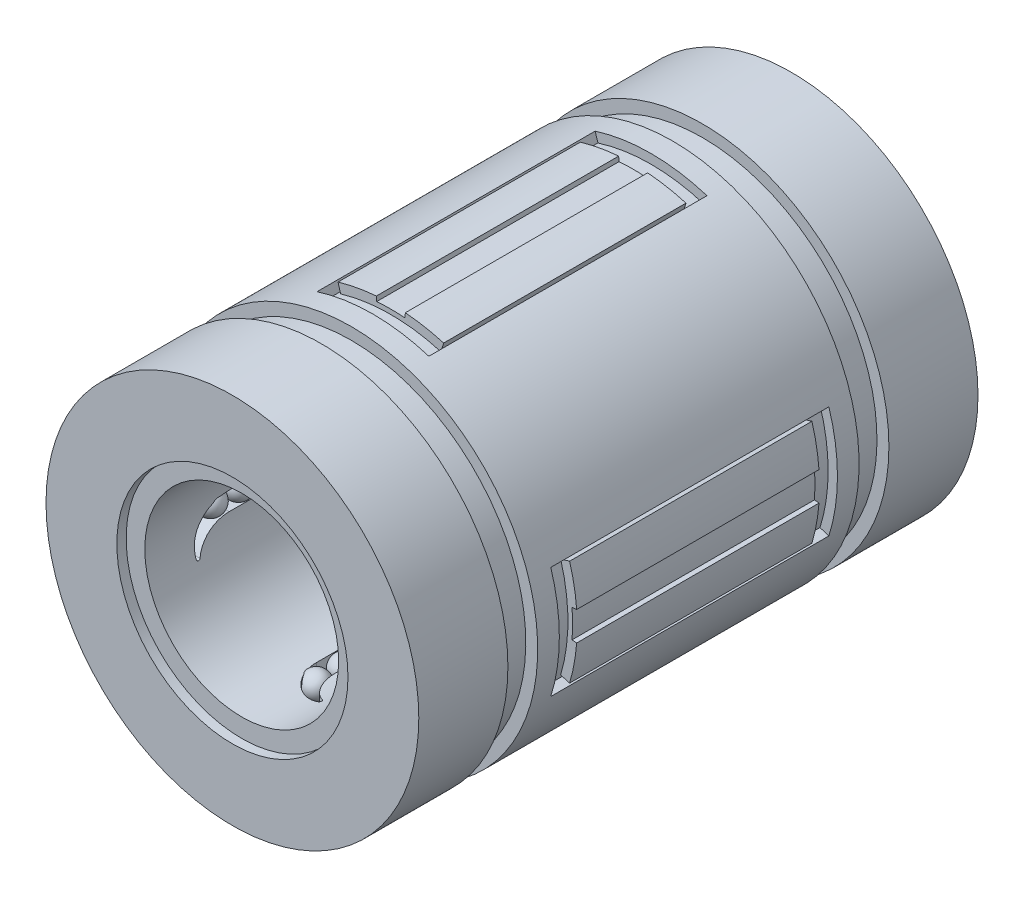
from build123d import *

# Parameters (mm, degrees)
SKETCH3_R               = 6.35
SKETCH3_R_2             = 3.302
BOSS_EXTRUDE1_DEPTH     = 9.525
CUT_EXTRUDE1_START      = -0.3175
SKETCH4_R               = 3.937
SKETCH4_R_2             = 3.302
CUT_EXTRUDE1_DEPTH      = 0.3175
CUT_EXTRUDE2_DEPTH      = 4.7371
BOSS_EXTRUDE2_DEPTH     = 4.1275
CUT_EXTRUDE3_REACH      = 15.091
CUT_EXTRUDE3_END_RADIUS = 3.937
LPATTERN1_COUNT         = 8
LPATTERN1_PITCH         = 0.9525
CIRPATTERN1_COUNT       = 4
CIRPATTERN2_COUNT       = 4
SKETCH9_W               = 1.015999937
SKETCH9_H               = 0.4064


with BuildPart() as part:
    # Sketch3 → Boss-Extrude1 (new, symmetric)
    with BuildSketch(Plane.XY):
        with Locations(Location((0, 0, 0), (0, 0, 180))):
            Circle(SKETCH3_R)
        with Locations(Location((0, 0, 0), (0, 0, 180))):
            Circle(SKETCH3_R_2, mode=Mode.SUBTRACT)
    extrude(amount=BOSS_EXTRUDE1_DEPTH, both=True)

    # Sketch4 → Cut-Extrude1 (cut)
    with BuildSketch(Plane.XY.offset(9.525).offset(CUT_EXTRUDE1_START)):
        Circle(SKETCH4_R)
        with Locations(Location((0, 0, 0), (0, 0, 180))):
            Circle(SKETCH4_R_2, mode=Mode.SUBTRACT)
    cut_extrude1 = extrude(amount=CUT_EXTRUDE1_DEPTH, mode=Mode.SUBTRACT)

    # Mirror1: Cut-Extrude1 across plane
    add(cut_extrude1.mirror(Plane.XY), mode=Mode.SUBTRACT)

    # Sketch5 → Cut-Extrude2 (cut, symmetric)
    with BuildSketch(Plane.XY):
        with BuildLine():
            Line((-1.905, 6.057513929), (-1.80975, 5.754638233))
            ThreePointArc((-1.80975, 5.754638233), (0, 6.0325), (1.80975, 5.754638233))
            Line((1.80975, 5.754638233), (1.905, 6.057513929))
            ThreePointArc((1.905, 6.057513929), (0, 6.35), (-1.905, 6.057513929))
        make_face()
    cut_extrude2 = extrude(amount=CUT_EXTRUDE2_DEPTH, both=True, mode=Mode.SUBTRACT)

    # Sketch6 → Boss-Extrude2 (add, symmetric)
    with BuildSketch(Plane.XY):
        with BuildLine():
            Line((1.798991664, 6.089838175), (1.709042081, 5.785346266))
            ThreePointArc((1.709042081, 5.785346266), (0, 6.0325), (-1.709042081, 5.785346266))
            Line((-1.709042081, 5.785346266), (-1.798991664, 6.089838175))
            ThreePointArc((-1.798991664, 6.089838175), (-1.152575174, 6.244523238), (-0.493530828, 6.330791998))
            Line((-0.493530828, 6.330791998), (-0.481192558, 6.172522198))
            ThreePointArc((-0.481192558, 6.172522198), (0, 6.19125), (0.481192558, 6.172522198))
            Line((0.481192558, 6.172522198), (0.493530828, 6.330791998))
            ThreePointArc((0.493530828, 6.330791998), (1.152575174, 6.244523238), (1.798991664, 6.089838175))
        make_face()
    boss_extrude2 = extrude(amount=BOSS_EXTRUDE2_DEPTH, both=True)

    # Cut-Extrude3: up to this cylinder (the profile starts inside it)
    cut_extrude3_end = Plane(origin=(0, 0, 0), z_dir=(0, 0, 1)) * Cylinder(CUT_EXTRUDE3_END_RADIUS, 39.056, mode=Mode.PRIVATE)
    # Sketch7 → Cut-Extrude3 (cut, up to the surface)
    with BuildSketch(Plane(origin=(0, 0, 0), x_dir=(0, 0, -1), z_dir=(1, 0, 0)), mode=Mode.PRIVATE) as cut_extrude3_sk1:
        with BuildLine():
            Line((-6.349999936, -0.3175), (6.349999936, -0.3175))
            ThreePointArc((6.349999936, -0.3175), (7.028843484, -0.514154094), (7.497454961, -1.043214278))
            ThreePointArc((7.497454961, -1.043214278), (7.567139834, -1.078294949), (7.618239701, -1.019342098))
            ThreePointArc((7.618239701, -1.019342098), (7.271354767, -0.078426052), (6.349999936, 0.3175))
            Line((6.349999936, 0.3175), (-6.349999936, 0.3175))
            ThreePointArc((-6.349999936, 0.3175), (-7.271354767, -0.078426052), (-7.618239701, -1.019342098))
            ThreePointArc((-7.618239701, -1.019342098), (-7.567139834, -1.078294949), (-7.497454961, -1.043214278))
            ThreePointArc((-7.497454961, -1.043214278), (-7.028843484, -0.514154094), (-6.349999936, -0.3175))
        make_face()
    cut_extrude3_tool1 = extrude(cut_extrude3_sk1.sketch, amount=-CUT_EXTRUDE3_REACH, mode=Mode.PRIVATE) & cut_extrude3_end
    cut_extrude3 = cut_extrude3_tool1.solids().sort_by_distance((0, -0.040905, 0))[0]
    add(cut_extrude3, mode=Mode.SUBTRACT)

    # Sketch8 → Revolve1 (revolve)
    with BuildSketch(Plane.XY):
        with BuildLine():
            Line((-3.605438414, 0.430438414), (-3.605438414, -0.430438414))
            ThreePointArc((-3.605438414, -0.430438414), (-3.175, 0), (-3.605438414, 0.430438414))
        make_face()
    revolve1 = revolve(axis=Axis((-3.605438414, 0.430438414, 0), (0, -1, 0)))

    # LPattern1: Revolve1 ×8
    with Locations(*[(0, 0, -i * LPATTERN1_PITCH) for i in range(1, LPATTERN1_COUNT)]):
        add(revolve1)

    # Mirror2 copy 1 sketch → Mirror2 copy 1 (revolve)
    with BuildSketch(Plane(origin=(0, 0, 0.9525), x_dir=(1, 0, 0), z_dir=(0, 0, -1))):
        with BuildLine():
            Line((-3.605438414, -0.430438414), (-3.605438414, 0.430438414))
            ThreePointArc((-3.605438414, 0.430438414), (-3.175, 0), (-3.605438414, -0.430438414))
        make_face()
    revolve(axis=Axis((-3.605438414, 0.430438414, 0.9525), (0, 1, 0)))

    # Mirror2 copy 2 sketch → Mirror2 copy 2 (revolve)
    with BuildSketch(Plane(origin=(0, 0, 1.905), x_dir=(1, 0, 0), z_dir=(0, 0, -1))):
        with BuildLine():
            Line((-3.605438414, -0.430438414), (-3.605438414, 0.430438414))
            ThreePointArc((-3.605438414, 0.430438414), (-3.175, 0), (-3.605438414, -0.430438414))
        make_face()
    revolve(axis=Axis((-3.605438414, 0.430438414, 1.905), (0, 1, 0)))

    # Mirror2 copy 3 sketch → Mirror2 copy 3 (revolve)
    with BuildSketch(Plane(origin=(0, 0, 2.8575), x_dir=(1, 0, 0), z_dir=(0, 0, -1))):
        with BuildLine():
            Line((-3.605438414, -0.430438414), (-3.605438414, 0.430438414))
            ThreePointArc((-3.605438414, 0.430438414), (-3.175, 0), (-3.605438414, -0.430438414))
        make_face()
    revolve(axis=Axis((-3.605438414, 0.430438414, 2.8575), (0, 1, 0)))

    # Mirror2 copy 4 sketch → Mirror2 copy 4 (revolve)
    with BuildSketch(Plane(origin=(0, 0, 3.81), x_dir=(1, 0, 0), z_dir=(0, 0, -1))):
        with BuildLine():
            Line((-3.605438414, -0.430438414), (-3.605438414, 0.430438414))
            ThreePointArc((-3.605438414, 0.430438414), (-3.175, 0), (-3.605438414, -0.430438414))
        make_face()
    revolve(axis=Axis((-3.605438414, 0.430438414, 3.81), (0, 1, 0)))

    # Mirror2 copy 5 sketch → Mirror2 copy 5 (revolve)
    with BuildSketch(Plane(origin=(0, 0, 4.7625), x_dir=(1, 0, 0), z_dir=(0, 0, -1))):
        with BuildLine():
            Line((-3.605438414, -0.430438414), (-3.605438414, 0.430438414))
            ThreePointArc((-3.605438414, 0.430438414), (-3.175, 0), (-3.605438414, -0.430438414))
        make_face()
    revolve(axis=Axis((-3.605438414, 0.430438414, 4.7625), (0, 1, 0)))

    # Mirror2 copy 6 sketch → Mirror2 copy 6 (revolve)
    with BuildSketch(Plane(origin=(0, 0, 5.715), x_dir=(1, 0, 0), z_dir=(0, 0, -1))):
        with BuildLine():
            Line((-3.605438414, -0.430438414), (-3.605438414, 0.430438414))
            ThreePointArc((-3.605438414, 0.430438414), (-3.175, 0), (-3.605438414, -0.430438414))
        make_face()
    revolve(axis=Axis((-3.605438414, 0.430438414, 5.715), (0, 1, 0)))

    # Mirror2 copy 7 sketch → Mirror2 copy 7 (revolve)
    with BuildSketch(Plane(origin=(0, 0, 6.6675), x_dir=(1, 0, 0), z_dir=(0, 0, -1))):
        with BuildLine():
            Line((-3.605438414, -0.430438414), (-3.605438414, 0.430438414))
            ThreePointArc((-3.605438414, 0.430438414), (-3.175, 0), (-3.605438414, -0.430438414))
        make_face()
    revolve(axis=Axis((-3.605438414, 0.430438414, 6.6675), (0, 1, 0)))

    # Mirror2 copy 8 sketch → Mirror2 copy 8 (revolve)
    with BuildSketch(Plane(origin=(0, 0, 0), x_dir=(1, 0, 0), z_dir=(0, 0, -1))):
        with BuildLine():
            Line((-3.605438414, -0.430438414), (-3.605438414, 0.430438414))
            ThreePointArc((-3.605438414, 0.430438414), (-3.175, 0), (-3.605438414, -0.430438414))
        make_face()
    revolve(axis=Axis((-3.605438414, 0.430438414, 0), (0, 1, 0)))

    # CirPattern1: Boss-Extrude2, Cut-Extrude3, Revolve1 ×4 about axis
    cirpattern1_axis = Axis((0, 0, 0), (0, 0, 1))
    add([boss_extrude2.rotate(cirpattern1_axis, i * 360 / CIRPATTERN1_COUNT) for i in range(1, CIRPATTERN1_COUNT)])
    add([cut_extrude3.rotate(cirpattern1_axis, i * 360 / CIRPATTERN1_COUNT) for i in range(1, CIRPATTERN1_COUNT)], mode=Mode.SUBTRACT)
    add([revolve1.rotate(cirpattern1_axis, i * 360 / CIRPATTERN1_COUNT) for i in range(1, CIRPATTERN1_COUNT)])

    # CirPattern1 copy 1 sketch → CirPattern1 copy 1 (revolve)
    with BuildSketch(Plane(origin=(0, 0, -0.9525), x_dir=(0, 1, 0), z_dir=(0, 0, 1))):
        with BuildLine():
            Line((-3.605438414, 0.430438414), (-3.605438414, -0.430438414))
            ThreePointArc((-3.605438414, -0.430438414), (-3.175, 0), (-3.605438414, 0.430438414))
        make_face()
    revolve(axis=Axis((-0.430438414, -3.605438414, -0.9525), (1, 0, 0)))

    # CirPattern1 copy 2 sketch → CirPattern1 copy 2 (revolve)
    with BuildSketch(Plane(origin=(0, 0, -0.9525), x_dir=(-1, 0, 0), z_dir=(0, 0, 1))):
        with BuildLine():
            Line((-3.605438414, 0.430438414), (-3.605438414, -0.430438414))
            ThreePointArc((-3.605438414, -0.430438414), (-3.175, 0), (-3.605438414, 0.430438414))
        make_face()
    revolve(axis=Axis((3.605438414, -0.430438414, -0.9525), (0, 1, 0)))

    # CirPattern1 copy 3 sketch → CirPattern1 copy 3 (revolve)
    with BuildSketch(Plane(origin=(0, 0, -0.9525), x_dir=(0, -1, 0), z_dir=(0, 0, 1))):
        with BuildLine():
            Line((-3.605438414, 0.430438414), (-3.605438414, -0.430438414))
            ThreePointArc((-3.605438414, -0.430438414), (-3.175, 0), (-3.605438414, 0.430438414))
        make_face()
    revolve(axis=Axis((0.430438414, 3.605438414, -0.9525), (-1, 0, 0)))

    # CirPattern1 copy 4 sketch → CirPattern1 copy 4 (revolve)
    with BuildSketch(Plane(origin=(0, 0, -1.905), x_dir=(0, 1, 0), z_dir=(0, 0, 1))):
        with BuildLine():
            Line((-3.605438414, 0.430438414), (-3.605438414, -0.430438414))
            ThreePointArc((-3.605438414, -0.430438414), (-3.175, 0), (-3.605438414, 0.430438414))
        make_face()
    revolve(axis=Axis((-0.430438414, -3.605438414, -1.905), (1, 0, 0)))

    # CirPattern1 copy 5 sketch → CirPattern1 copy 5 (revolve)
    with BuildSketch(Plane(origin=(0, 0, -1.905), x_dir=(-1, 0, 0), z_dir=(0, 0, 1))):
        with BuildLine():
            Line((-3.605438414, 0.430438414), (-3.605438414, -0.430438414))
            ThreePointArc((-3.605438414, -0.430438414), (-3.175, 0), (-3.605438414, 0.430438414))
        make_face()
    revolve(axis=Axis((3.605438414, -0.430438414, -1.905), (0, 1, 0)))

    # CirPattern1 copy 6 sketch → CirPattern1 copy 6 (revolve)
    with BuildSketch(Plane(origin=(0, 0, -1.905), x_dir=(0, -1, 0), z_dir=(0, 0, 1))):
        with BuildLine():
            Line((-3.605438414, 0.430438414), (-3.605438414, -0.430438414))
            ThreePointArc((-3.605438414, -0.430438414), (-3.175, 0), (-3.605438414, 0.430438414))
        make_face()
    revolve(axis=Axis((0.430438414, 3.605438414, -1.905), (-1, 0, 0)))

    # CirPattern1 copy 7 sketch → CirPattern1 copy 7 (revolve)
    with BuildSketch(Plane(origin=(0, 0, -2.8575), x_dir=(0, 1, 0), z_dir=(0, 0, 1))):
        with BuildLine():
            Line((-3.605438414, 0.430438414), (-3.605438414, -0.430438414))
            ThreePointArc((-3.605438414, -0.430438414), (-3.175, 0), (-3.605438414, 0.430438414))
        make_face()
    revolve(axis=Axis((-0.430438414, -3.605438414, -2.8575), (1, 0, 0)))

    # CirPattern1 copy 8 sketch → CirPattern1 copy 8 (revolve)
    with BuildSketch(Plane(origin=(0, 0, -2.8575), x_dir=(-1, 0, 0), z_dir=(0, 0, 1))):
        with BuildLine():
            Line((-3.605438414, 0.430438414), (-3.605438414, -0.430438414))
            ThreePointArc((-3.605438414, -0.430438414), (-3.175, 0), (-3.605438414, 0.430438414))
        make_face()
    revolve(axis=Axis((3.605438414, -0.430438414, -2.8575), (0, 1, 0)))

    # CirPattern1 copy 9 sketch → CirPattern1 copy 9 (revolve)
    with BuildSketch(Plane(origin=(0, 0, -2.8575), x_dir=(0, -1, 0), z_dir=(0, 0, 1))):
        with BuildLine():
            Line((-3.605438414, 0.430438414), (-3.605438414, -0.430438414))
            ThreePointArc((-3.605438414, -0.430438414), (-3.175, 0), (-3.605438414, 0.430438414))
        make_face()
    revolve(axis=Axis((0.430438414, 3.605438414, -2.8575), (-1, 0, 0)))

    # CirPattern1 copy 10 sketch → CirPattern1 copy 10 (revolve)
    with BuildSketch(Plane(origin=(0, 0, -3.81), x_dir=(0, 1, 0), z_dir=(0, 0, 1))):
        with BuildLine():
            Line((-3.605438414, 0.430438414), (-3.605438414, -0.430438414))
            ThreePointArc((-3.605438414, -0.430438414), (-3.175, 0), (-3.605438414, 0.430438414))
        make_face()
    revolve(axis=Axis((-0.430438414, -3.605438414, -3.81), (1, 0, 0)))

    # CirPattern1 copy 11 sketch → CirPattern1 copy 11 (revolve)
    with BuildSketch(Plane(origin=(0, 0, -3.81), x_dir=(-1, 0, 0), z_dir=(0, 0, 1))):
        with BuildLine():
            Line((-3.605438414, 0.430438414), (-3.605438414, -0.430438414))
            ThreePointArc((-3.605438414, -0.430438414), (-3.175, 0), (-3.605438414, 0.430438414))
        make_face()
    revolve(axis=Axis((3.605438414, -0.430438414, -3.81), (0, 1, 0)))

    # CirPattern1 copy 12 sketch → CirPattern1 copy 12 (revolve)
    with BuildSketch(Plane(origin=(0, 0, -3.81), x_dir=(0, -1, 0), z_dir=(0, 0, 1))):
        with BuildLine():
            Line((-3.605438414, 0.430438414), (-3.605438414, -0.430438414))
            ThreePointArc((-3.605438414, -0.430438414), (-3.175, 0), (-3.605438414, 0.430438414))
        make_face()
    revolve(axis=Axis((0.430438414, 3.605438414, -3.81), (-1, 0, 0)))

    # CirPattern1 copy 13 sketch → CirPattern1 copy 13 (revolve)
    with BuildSketch(Plane(origin=(0, 0, -4.7625), x_dir=(0, 1, 0), z_dir=(0, 0, 1))):
        with BuildLine():
            Line((-3.605438414, 0.430438414), (-3.605438414, -0.430438414))
            ThreePointArc((-3.605438414, -0.430438414), (-3.175, 0), (-3.605438414, 0.430438414))
        make_face()
    revolve(axis=Axis((-0.430438414, -3.605438414, -4.7625), (1, 0, 0)))

    # CirPattern1 copy 14 sketch → CirPattern1 copy 14 (revolve)
    with BuildSketch(Plane(origin=(0, 0, -4.7625), x_dir=(-1, 0, 0), z_dir=(0, 0, 1))):
        with BuildLine():
            Line((-3.605438414, 0.430438414), (-3.605438414, -0.430438414))
            ThreePointArc((-3.605438414, -0.430438414), (-3.175, 0), (-3.605438414, 0.430438414))
        make_face()
    revolve(axis=Axis((3.605438414, -0.430438414, -4.7625), (0, 1, 0)))

    # CirPattern1 copy 15 sketch → CirPattern1 copy 15 (revolve)
    with BuildSketch(Plane(origin=(0, 0, -4.7625), x_dir=(0, -1, 0), z_dir=(0, 0, 1))):
        with BuildLine():
            Line((-3.605438414, 0.430438414), (-3.605438414, -0.430438414))
            ThreePointArc((-3.605438414, -0.430438414), (-3.175, 0), (-3.605438414, 0.430438414))
        make_face()
    revolve(axis=Axis((0.430438414, 3.605438414, -4.7625), (-1, 0, 0)))

    # CirPattern1 copy 16 sketch → CirPattern1 copy 16 (revolve)
    with BuildSketch(Plane(origin=(0, 0, -5.715), x_dir=(0, 1, 0), z_dir=(0, 0, 1))):
        with BuildLine():
            Line((-3.605438414, 0.430438414), (-3.605438414, -0.430438414))
            ThreePointArc((-3.605438414, -0.430438414), (-3.175, 0), (-3.605438414, 0.430438414))
        make_face()
    revolve(axis=Axis((-0.430438414, -3.605438414, -5.715), (1, 0, 0)))

    # CirPattern1 copy 17 sketch → CirPattern1 copy 17 (revolve)
    with BuildSketch(Plane(origin=(0, 0, -5.715), x_dir=(-1, 0, 0), z_dir=(0, 0, 1))):
        with BuildLine():
            Line((-3.605438414, 0.430438414), (-3.605438414, -0.430438414))
            ThreePointArc((-3.605438414, -0.430438414), (-3.175, 0), (-3.605438414, 0.430438414))
        make_face()
    revolve(axis=Axis((3.605438414, -0.430438414, -5.715), (0, 1, 0)))

    # CirPattern1 copy 18 sketch → CirPattern1 copy 18 (revolve)
    with BuildSketch(Plane(origin=(0, 0, -5.715), x_dir=(0, -1, 0), z_dir=(0, 0, 1))):
        with BuildLine():
            Line((-3.605438414, 0.430438414), (-3.605438414, -0.430438414))
            ThreePointArc((-3.605438414, -0.430438414), (-3.175, 0), (-3.605438414, 0.430438414))
        make_face()
    revolve(axis=Axis((0.430438414, 3.605438414, -5.715), (-1, 0, 0)))

    # CirPattern1 copy 19 sketch → CirPattern1 copy 19 (revolve)
    with BuildSketch(Plane(origin=(0, 0, -6.6675), x_dir=(0, 1, 0), z_dir=(0, 0, 1))):
        with BuildLine():
            Line((-3.605438414, 0.430438414), (-3.605438414, -0.430438414))
            ThreePointArc((-3.605438414, -0.430438414), (-3.175, 0), (-3.605438414, 0.430438414))
        make_face()
    revolve(axis=Axis((-0.430438414, -3.605438414, -6.6675), (1, 0, 0)))

    # CirPattern1 copy 20 sketch → CirPattern1 copy 20 (revolve)
    with BuildSketch(Plane(origin=(0, 0, -6.6675), x_dir=(-1, 0, 0), z_dir=(0, 0, 1))):
        with BuildLine():
            Line((-3.605438414, 0.430438414), (-3.605438414, -0.430438414))
            ThreePointArc((-3.605438414, -0.430438414), (-3.175, 0), (-3.605438414, 0.430438414))
        make_face()
    revolve(axis=Axis((3.605438414, -0.430438414, -6.6675), (0, 1, 0)))

    # CirPattern1 copy 21 sketch → CirPattern1 copy 21 (revolve)
    with BuildSketch(Plane(origin=(0, 0, -6.6675), x_dir=(0, -1, 0), z_dir=(0, 0, 1))):
        with BuildLine():
            Line((-3.605438414, 0.430438414), (-3.605438414, -0.430438414))
            ThreePointArc((-3.605438414, -0.430438414), (-3.175, 0), (-3.605438414, 0.430438414))
        make_face()
    revolve(axis=Axis((0.430438414, 3.605438414, -6.6675), (-1, 0, 0)))

    # CirPattern1 copy 22 sketch → CirPattern1 copy 22 (revolve)
    with BuildSketch(Plane.YX.offset(-0.9525)):
        with BuildLine():
            Line((-3.605438414, -0.430438414), (-3.605438414, 0.430438414))
            ThreePointArc((-3.605438414, 0.430438414), (-3.175, 0), (-3.605438414, -0.430438414))
        make_face()
    revolve(axis=Axis((-0.430438414, -3.605438414, 0.9525), (-1, 0, 0)))

    # CirPattern1 copy 23 sketch → CirPattern1 copy 23 (revolve)
    with BuildSketch(Plane(origin=(0, 0, 0.9525), x_dir=(-1, 0, 0), z_dir=(0, 0, -1))):
        with BuildLine():
            Line((-3.605438414, -0.430438414), (-3.605438414, 0.430438414))
            ThreePointArc((-3.605438414, 0.430438414), (-3.175, 0), (-3.605438414, -0.430438414))
        make_face()
    revolve(axis=Axis((3.605438414, -0.430438414, 0.9525), (0, -1, 0)))

    # CirPattern1 copy 24 sketch → CirPattern1 copy 24 (revolve)
    with BuildSketch(Plane(origin=(0, 0, 0.9525), x_dir=(0, -1, 0), z_dir=(0, 0, -1))):
        with BuildLine():
            Line((-3.605438414, -0.430438414), (-3.605438414, 0.430438414))
            ThreePointArc((-3.605438414, 0.430438414), (-3.175, 0), (-3.605438414, -0.430438414))
        make_face()
    revolve(axis=Axis((0.430438414, 3.605438414, 0.9525), (1, 0, 0)))

    # CirPattern1 copy 25 sketch → CirPattern1 copy 25 (revolve)
    with BuildSketch(Plane.YX.offset(-1.905)):
        with BuildLine():
            Line((-3.605438414, -0.430438414), (-3.605438414, 0.430438414))
            ThreePointArc((-3.605438414, 0.430438414), (-3.175, 0), (-3.605438414, -0.430438414))
        make_face()
    revolve(axis=Axis((-0.430438414, -3.605438414, 1.905), (-1, 0, 0)))

    # CirPattern1 copy 26 sketch → CirPattern1 copy 26 (revolve)
    with BuildSketch(Plane(origin=(0, 0, 1.905), x_dir=(-1, 0, 0), z_dir=(0, 0, -1))):
        with BuildLine():
            Line((-3.605438414, -0.430438414), (-3.605438414, 0.430438414))
            ThreePointArc((-3.605438414, 0.430438414), (-3.175, 0), (-3.605438414, -0.430438414))
        make_face()
    revolve(axis=Axis((3.605438414, -0.430438414, 1.905), (0, -1, 0)))

    # CirPattern1 copy 27 sketch → CirPattern1 copy 27 (revolve)
    with BuildSketch(Plane(origin=(0, 0, 1.905), x_dir=(0, -1, 0), z_dir=(0, 0, -1))):
        with BuildLine():
            Line((-3.605438414, -0.430438414), (-3.605438414, 0.430438414))
            ThreePointArc((-3.605438414, 0.430438414), (-3.175, 0), (-3.605438414, -0.430438414))
        make_face()
    revolve(axis=Axis((0.430438414, 3.605438414, 1.905), (1, 0, 0)))

    # CirPattern1 copy 28 sketch → CirPattern1 copy 28 (revolve)
    with BuildSketch(Plane.YX.offset(-2.8575)):
        with BuildLine():
            Line((-3.605438414, -0.430438414), (-3.605438414, 0.430438414))
            ThreePointArc((-3.605438414, 0.430438414), (-3.175, 0), (-3.605438414, -0.430438414))
        make_face()
    revolve(axis=Axis((-0.430438414, -3.605438414, 2.8575), (-1, 0, 0)))

    # CirPattern1 copy 29 sketch → CirPattern1 copy 29 (revolve)
    with BuildSketch(Plane(origin=(0, 0, 2.8575), x_dir=(-1, 0, 0), z_dir=(0, 0, -1))):
        with BuildLine():
            Line((-3.605438414, -0.430438414), (-3.605438414, 0.430438414))
            ThreePointArc((-3.605438414, 0.430438414), (-3.175, 0), (-3.605438414, -0.430438414))
        make_face()
    revolve(axis=Axis((3.605438414, -0.430438414, 2.8575), (0, -1, 0)))

    # CirPattern1 copy 30 sketch → CirPattern1 copy 30 (revolve)
    with BuildSketch(Plane(origin=(0, 0, 2.8575), x_dir=(0, -1, 0), z_dir=(0, 0, -1))):
        with BuildLine():
            Line((-3.605438414, -0.430438414), (-3.605438414, 0.430438414))
            ThreePointArc((-3.605438414, 0.430438414), (-3.175, 0), (-3.605438414, -0.430438414))
        make_face()
    revolve(axis=Axis((0.430438414, 3.605438414, 2.8575), (1, 0, 0)))

    # CirPattern1 copy 31 sketch → CirPattern1 copy 31 (revolve)
    with BuildSketch(Plane.YX.offset(-3.81)):
        with BuildLine():
            Line((-3.605438414, -0.430438414), (-3.605438414, 0.430438414))
            ThreePointArc((-3.605438414, 0.430438414), (-3.175, 0), (-3.605438414, -0.430438414))
        make_face()
    revolve(axis=Axis((-0.430438414, -3.605438414, 3.81), (-1, 0, 0)))

    # CirPattern1 copy 32 sketch → CirPattern1 copy 32 (revolve)
    with BuildSketch(Plane(origin=(0, 0, 3.81), x_dir=(-1, 0, 0), z_dir=(0, 0, -1))):
        with BuildLine():
            Line((-3.605438414, -0.430438414), (-3.605438414, 0.430438414))
            ThreePointArc((-3.605438414, 0.430438414), (-3.175, 0), (-3.605438414, -0.430438414))
        make_face()
    revolve(axis=Axis((3.605438414, -0.430438414, 3.81), (0, -1, 0)))

    # CirPattern1 copy 33 sketch → CirPattern1 copy 33 (revolve)
    with BuildSketch(Plane(origin=(0, 0, 3.81), x_dir=(0, -1, 0), z_dir=(0, 0, -1))):
        with BuildLine():
            Line((-3.605438414, -0.430438414), (-3.605438414, 0.430438414))
            ThreePointArc((-3.605438414, 0.430438414), (-3.175, 0), (-3.605438414, -0.430438414))
        make_face()
    revolve(axis=Axis((0.430438414, 3.605438414, 3.81), (1, 0, 0)))

    # CirPattern1 copy 34 sketch → CirPattern1 copy 34 (revolve)
    with BuildSketch(Plane.YX.offset(-4.7625)):
        with BuildLine():
            Line((-3.605438414, -0.430438414), (-3.605438414, 0.430438414))
            ThreePointArc((-3.605438414, 0.430438414), (-3.175, 0), (-3.605438414, -0.430438414))
        make_face()
    revolve(axis=Axis((-0.430438414, -3.605438414, 4.7625), (-1, 0, 0)))

    # CirPattern1 copy 35 sketch → CirPattern1 copy 35 (revolve)
    with BuildSketch(Plane(origin=(0, 0, 4.7625), x_dir=(-1, 0, 0), z_dir=(0, 0, -1))):
        with BuildLine():
            Line((-3.605438414, -0.430438414), (-3.605438414, 0.430438414))
            ThreePointArc((-3.605438414, 0.430438414), (-3.175, 0), (-3.605438414, -0.430438414))
        make_face()
    revolve(axis=Axis((3.605438414, -0.430438414, 4.7625), (0, -1, 0)))

    # CirPattern1 copy 36 sketch → CirPattern1 copy 36 (revolve)
    with BuildSketch(Plane(origin=(0, 0, 4.7625), x_dir=(0, -1, 0), z_dir=(0, 0, -1))):
        with BuildLine():
            Line((-3.605438414, -0.430438414), (-3.605438414, 0.430438414))
            ThreePointArc((-3.605438414, 0.430438414), (-3.175, 0), (-3.605438414, -0.430438414))
        make_face()
    revolve(axis=Axis((0.430438414, 3.605438414, 4.7625), (1, 0, 0)))

    # CirPattern1 copy 37 sketch → CirPattern1 copy 37 (revolve)
    with BuildSketch(Plane.YX.offset(-5.715)):
        with BuildLine():
            Line((-3.605438414, -0.430438414), (-3.605438414, 0.430438414))
            ThreePointArc((-3.605438414, 0.430438414), (-3.175, 0), (-3.605438414, -0.430438414))
        make_face()
    revolve(axis=Axis((-0.430438414, -3.605438414, 5.715), (-1, 0, 0)))

    # CirPattern1 copy 38 sketch → CirPattern1 copy 38 (revolve)
    with BuildSketch(Plane(origin=(0, 0, 5.715), x_dir=(-1, 0, 0), z_dir=(0, 0, -1))):
        with BuildLine():
            Line((-3.605438414, -0.430438414), (-3.605438414, 0.430438414))
            ThreePointArc((-3.605438414, 0.430438414), (-3.175, 0), (-3.605438414, -0.430438414))
        make_face()
    revolve(axis=Axis((3.605438414, -0.430438414, 5.715), (0, -1, 0)))

    # CirPattern1 copy 39 sketch → CirPattern1 copy 39 (revolve)
    with BuildSketch(Plane(origin=(0, 0, 5.715), x_dir=(0, -1, 0), z_dir=(0, 0, -1))):
        with BuildLine():
            Line((-3.605438414, -0.430438414), (-3.605438414, 0.430438414))
            ThreePointArc((-3.605438414, 0.430438414), (-3.175, 0), (-3.605438414, -0.430438414))
        make_face()
    revolve(axis=Axis((0.430438414, 3.605438414, 5.715), (1, 0, 0)))

    # CirPattern1 copy 40 sketch → CirPattern1 copy 40 (revolve)
    with BuildSketch(Plane.YX.offset(-6.6675)):
        with BuildLine():
            Line((-3.605438414, -0.430438414), (-3.605438414, 0.430438414))
            ThreePointArc((-3.605438414, 0.430438414), (-3.175, 0), (-3.605438414, -0.430438414))
        make_face()
    revolve(axis=Axis((-0.430438414, -3.605438414, 6.6675), (-1, 0, 0)))

    # CirPattern1 copy 41 sketch → CirPattern1 copy 41 (revolve)
    with BuildSketch(Plane(origin=(0, 0, 6.6675), x_dir=(-1, 0, 0), z_dir=(0, 0, -1))):
        with BuildLine():
            Line((-3.605438414, -0.430438414), (-3.605438414, 0.430438414))
            ThreePointArc((-3.605438414, 0.430438414), (-3.175, 0), (-3.605438414, -0.430438414))
        make_face()
    revolve(axis=Axis((3.605438414, -0.430438414, 6.6675), (0, -1, 0)))

    # CirPattern1 copy 42 sketch → CirPattern1 copy 42 (revolve)
    with BuildSketch(Plane(origin=(0, 0, 6.6675), x_dir=(0, -1, 0), z_dir=(0, 0, -1))):
        with BuildLine():
            Line((-3.605438414, -0.430438414), (-3.605438414, 0.430438414))
            ThreePointArc((-3.605438414, 0.430438414), (-3.175, 0), (-3.605438414, -0.430438414))
        make_face()
    revolve(axis=Axis((0.430438414, 3.605438414, 6.6675), (1, 0, 0)))

    # CirPattern1 copy 43 sketch → CirPattern1 copy 43 (revolve)
    with BuildSketch(Plane.YX):
        with BuildLine():
            Line((-3.605438414, -0.430438414), (-3.605438414, 0.430438414))
            ThreePointArc((-3.605438414, 0.430438414), (-3.175, 0), (-3.605438414, -0.430438414))
        make_face()
    revolve(axis=Axis((-0.430438414, -3.605438414, 0), (-1, 0, 0)))

    # CirPattern1 copy 44 sketch → CirPattern1 copy 44 (revolve)
    with BuildSketch(Plane(origin=(0, 0, 0), x_dir=(-1, 0, 0), z_dir=(0, 0, -1))):
        with BuildLine():
            Line((-3.605438414, -0.430438414), (-3.605438414, 0.430438414))
            ThreePointArc((-3.605438414, 0.430438414), (-3.175, 0), (-3.605438414, -0.430438414))
        make_face()
    revolve(axis=Axis((3.605438414, -0.430438414, 0), (0, -1, 0)))

    # CirPattern1 copy 45 sketch → CirPattern1 copy 45 (revolve)
    with BuildSketch(Plane(origin=(0, 0, 0), x_dir=(0, -1, 0), z_dir=(0, 0, -1))):
        with BuildLine():
            Line((-3.605438414, -0.430438414), (-3.605438414, 0.430438414))
            ThreePointArc((-3.605438414, 0.430438414), (-3.175, 0), (-3.605438414, -0.430438414))
        make_face()
    revolve(axis=Axis((0.430438414, 3.605438414, 0), (1, 0, 0)))

    # CirPattern2: Cut-Extrude2, Boss-Extrude2 ×4 about axis
    cirpattern2_axis = Axis((0, 0, 9.525), (0, 0, -1))
    add([cut_extrude2.rotate(cirpattern2_axis, i * 360 / CIRPATTERN2_COUNT) for i in range(1, CIRPATTERN2_COUNT)], mode=Mode.SUBTRACT)
    add([boss_extrude2.rotate(cirpattern2_axis, i * 360 / CIRPATTERN2_COUNT) for i in range(1, CIRPATTERN2_COUNT)])

    # Sketch9 → Cut-Revolve1 (revolve, cut)
    with BuildSketch(Plane(origin=(0, 0, 0), x_dir=(0, 0, -1), z_dir=(1, 0, 0))):
        with Locations((5.981700032, 6.1468)):
            Rectangle(SKETCH9_W, SKETCH9_H)
        with Locations((-5.981700032, 6.1468)):
            Rectangle(SKETCH9_W, SKETCH9_H)
    revolve(axis=Axis((0, 0, -9.525), (0, 0, 1)), mode=Mode.SUBTRACT)


solid = part.part
